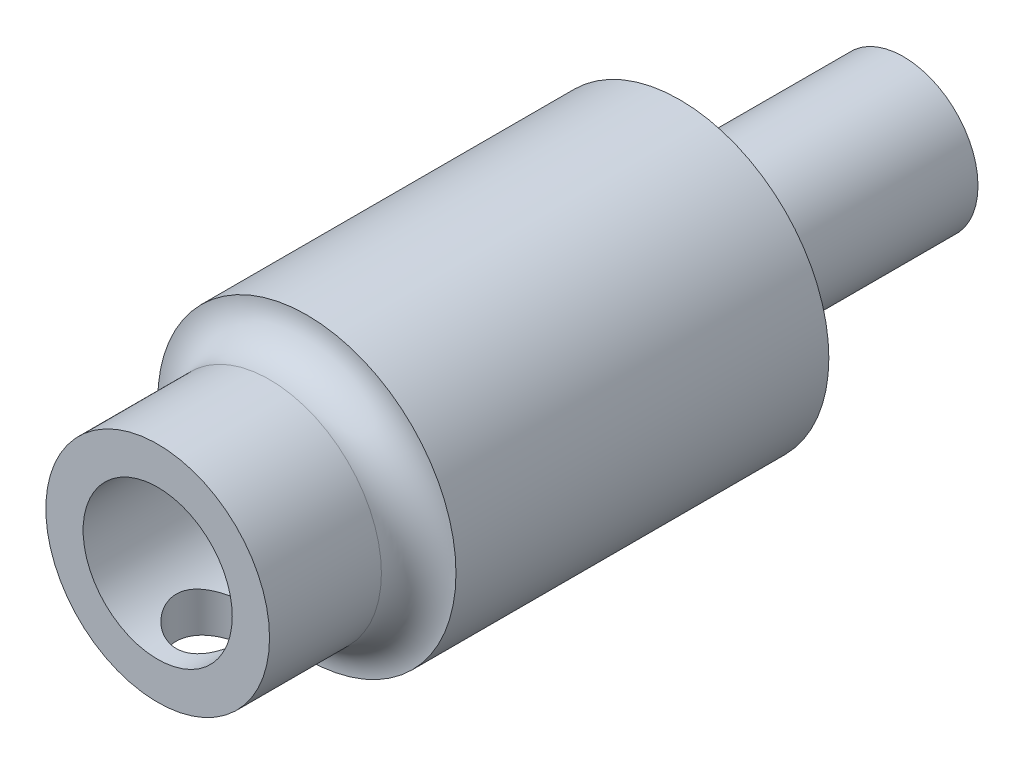
from build123d import *

# Parameters (mm, degrees)
ESQUISSE1_R             = 2
BOSS_EXTRU_1_DEPTH      = 5
ESQUISSE2_R             = 1.5
ESQUISSE2_R_2           = 1
BOSS_EXTRU_2_DEPTH      = 2
BOSS_EXTRU_3_START      = 3
ESQUISSE3_R             = 1
ESQUISSE3_R_2           = 0.5
BOSS_EXTRU_3_DEPTH      = 3
CONG_1_R                = 0.5
CONG_2_R                = 0.5
ESQUISSE5_R             = 0.5
ENL_V_MAT_EXTRU_1_DEPTH = 2


with BuildPart() as part:
    # Esquisse1 → Boss.-Extru.1 (new body)
    with BuildSketch(Plane.XY):
        Circle(ESQUISSE1_R)
    extrude(amount=BOSS_EXTRU_1_DEPTH)

    # Esquisse2 → Boss.-Extru.2 (add)
    with BuildSketch(Plane.XY.offset(5)):
        Circle(ESQUISSE2_R)
        Circle(ESQUISSE2_R_2, mode=Mode.SUBTRACT)
    extrude(amount=BOSS_EXTRU_2_DEPTH)

    # Esquisse3 → Boss.-Extru.3 (add)
    with BuildSketch(Plane(origin=(0, 0, 0), x_dir=(-1, 0, 0), z_dir=(0, 0, -1)).offset(BOSS_EXTRU_3_START)):
        with Locations(Location((0, 0, 0), (0, 0, 180))):
            Circle(ESQUISSE3_R)
        Circle(ESQUISSE3_R_2, mode=Mode.SUBTRACT)
    extrude(amount=-BOSS_EXTRU_3_DEPTH)

    # Congé1
    cong_1_edges = [part.edges().sort_by_distance(p)[0] for p in [
        (-1, 0, 0),
    ]]
    fillet(cong_1_edges, radius=CONG_1_R)

    # Congé2
    cong_2_edges = [part.edges().sort_by_distance(p)[0] for p in [
        (-1.5, 0, 5),
    ]]
    fillet(cong_2_edges, radius=CONG_2_R - 0.0001)  # a hair under: the kernel refuses the full size

    # Esquisse5 → Enlèv. mat.-Extru.1 (cut)
    with BuildSketch(Plane(origin=(0, 0, 0), x_dir=(1, 0, 0), z_dir=(0, 1, 0))):
        with Locations(Location((0, 1.75, 0), (0, 0, 270))):
            Circle(ESQUISSE5_R)
        with Locations(Location((0, -6.25, 0), (0, 0, 270))):
            Circle(ESQUISSE5_R)
    extrude(amount=-ENL_V_MAT_EXTRU_1_DEPTH, mode=Mode.SUBTRACT)


solid = part.part
